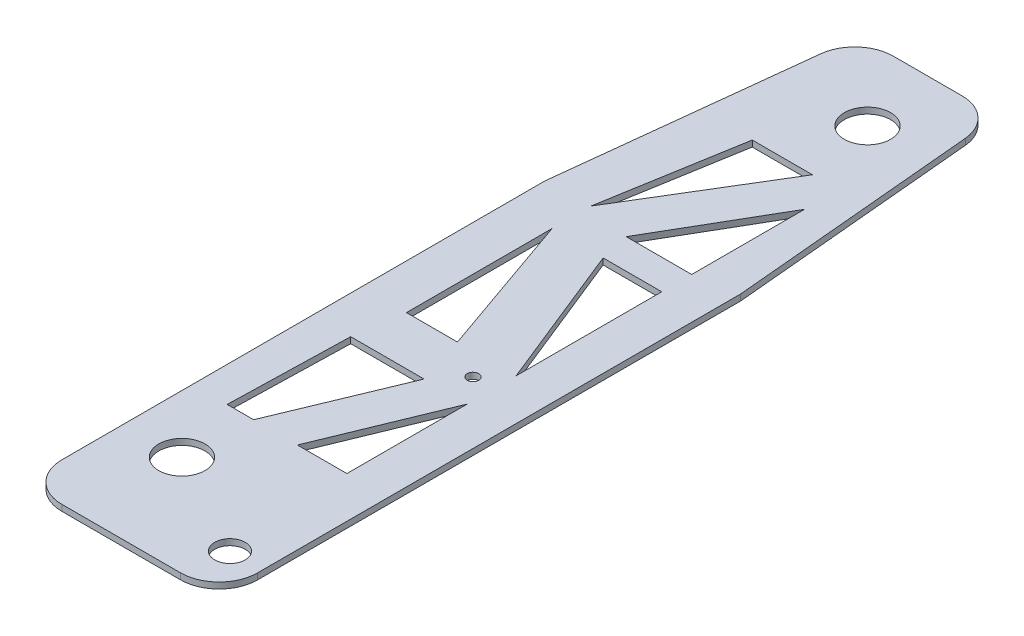
from build123d import *

# Parameters (mm, degrees)
SKETCH1_R           = 5.969
SKETCH1_R_2         = 3.960069723
SKETCH1_R_3         = 6
BOSS_EXTRUDE1_DEPTH = 1.5875
FILLET1_R           = 10
CUT_EXTRUDE1_DEPTH  = 10
SKETCH4_W           = 66.272407177
SKETCH4_H           = 27.800260981
CUT_EXTRUDE2_DEPTH  = 20
FILLET2_R           = 10
SKETCH5_R           = 6.683690244
BOSS_EXTRUDE2_DEPTH = 1.5875
SKETCH6_R           = 6
CUT_EXTRUDE3_DEPTH  = 2
FILLET3_R           = 10
SKETCH7_R           = 1.5
CUT_EXTRUDE4_DEPTH  = 3.175


with BuildPart() as part:
    # Sketch1 → Boss-Extrude1 (new body)
    with BuildSketch(Plane(origin=(0, 0, 0), x_dir=(1, 0, 0), z_dir=(0, 1, 0))):
        Polygon((42.32729629, 228.6), (10.454309325, 228.6), (0, 135.362739137), (0, 0), (24.327009544, 0), (50.8, 0), (50.8, 135.362739137), align=None)
        with Locations((24.327009544, 25.509186042)):
            Circle(SKETCH1_R, mode=Mode.SUBTRACT)
        with Locations((42.32729629, 11.29561028)):
            Circle(SKETCH1_R_2, mode=Mode.SUBTRACT)
        with Locations((29.504213454, 189.557234372)):
            Circle(SKETCH1_R_3, mode=Mode.SUBTRACT)
    extrude(amount=BOSS_EXTRUDE1_DEPTH)

    # Fillet1
    fillet1_edges = [part.edges().sort_by_distance(p)[0] for p in [
        (0, 0.79375, -135.362739137),
        (10.454309325, 0.79375, -228.6),
        (50.8, 0.79375, 0),
        (0, 0.79375, 0),
    ]]
    fillet(fillet1_edges, radius=FILLET1_R)

    # Sketch2 → Cut-Extrude1 (cut)
    with BuildSketch(Plane(origin=(0, 1.5875, 0), x_dir=(1, 0, 0), z_dir=(0, 1, 0))):
        Polygon((17.710313686, 171.447292022), (11.625887928, 135.682824493), (33.327013171, 171.447292022), align=None)
        Polygon((40.069984314, 162.673375682), (40.069984314, 137.652327322), (40.069984314, 133.37242009), (23.073725904, 133.37242009), align=None)
        Polygon((11.625887928, 125.596148764), (11.625887928, 87.797541575), (24.859509964, 87.797541575), align=None)
        Polygon((24.859509964, 125.596148764), (40.069984314, 125.596148764), (40.069984314, 87.797541575), align=None)
        Polygon((28.8433603, 75.147356803), (9.809028696, 75.147356803), (9.002021985, 43.891436344), (15.87323788, 43.891436344), align=None)
        Polygon((40.069984314, 75.147356803), (40.069984314, 43.891436344), (31.278449047, 43.891436344), (27.238493662, 43.891436344), align=None)
    extrude(amount=-CUT_EXTRUDE1_DEPTH, mode=Mode.SUBTRACT)

    # Sketch4 → Cut-Extrude2 (cut)
    with BuildSketch(Plane(origin=(0, 0, -228.6), x_dir=(-1, 0, 0), z_dir=(0, 0, -1))):
        with Locations((-28.174690156, -1.980940155)):
            Rectangle(SKETCH4_W, SKETCH4_H)
    extrude(amount=-CUT_EXTRUDE2_DEPTH, mode=Mode.SUBTRACT)

    # Fillet2
    fillet2_edges = [part.edges().sort_by_distance(p)[0] for p in [
        (8.211791854, 0.79375, -208.6),
    ]]
    fillet(fillet2_edges, radius=FILLET2_R)

    # Sketch5 → Boss-Extrude2 (add)
    with BuildSketch(Plane.XZ):
        with Locations((24.327009544, -25.509186042)):
            Circle(SKETCH5_R)
    extrude(amount=-BOSS_EXTRUDE2_DEPTH)

    # Sketch6 → Cut-Extrude3 (cut)
    with BuildSketch(Plane.XZ):
        with Locations((15, -26.149675445)):
            Circle(SKETCH6_R)
    extrude(amount=-CUT_EXTRUDE3_DEPTH, mode=Mode.SUBTRACT)

    # Fillet3
    fillet3_edges = [part.edges().sort_by_distance(p)[0] for p in [
        (44.144746445, 0.79375, -208.6),
    ]]
    fillet(fillet3_edges, radius=FILLET3_R)

    # Sketch7 → Cut-Extrude4 (cut)
    with BuildSketch(Plane.XZ):
        with Locations((34.714005998, -81.958115223)):
            Circle(SKETCH7_R)
    extrude(amount=-CUT_EXTRUDE4_DEPTH, mode=Mode.SUBTRACT)


solid = part.part
